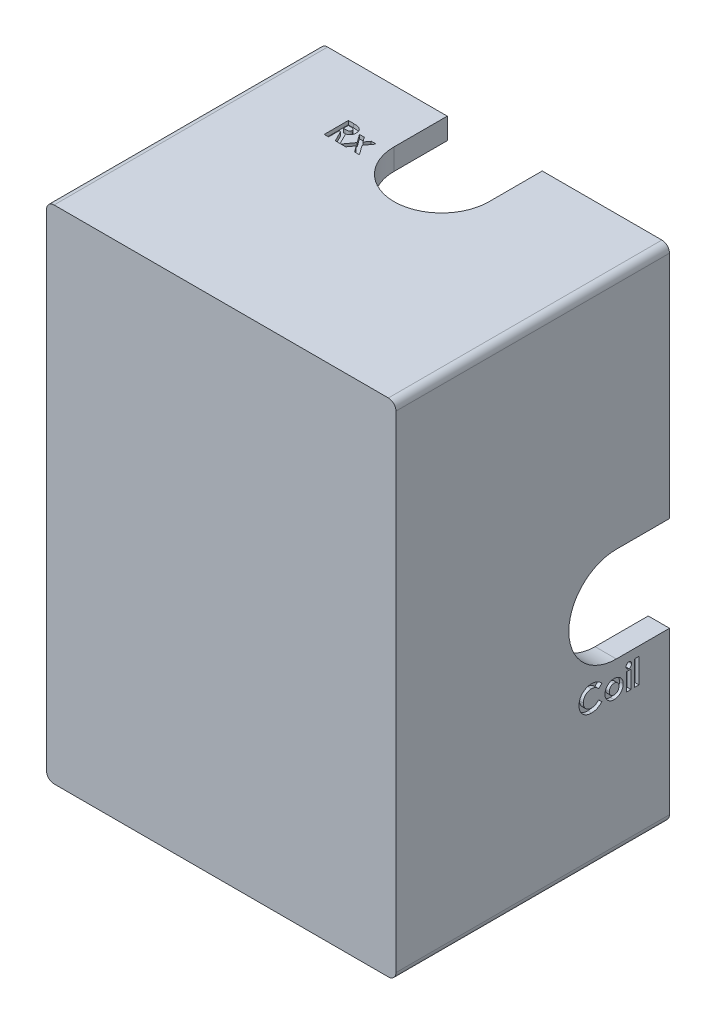
from build123d import *

# Parameters (mm, degrees)
SKETCH2_W            = 40
SKETCH2_H            = 33
BOSS_EXTRUDE3_DEPTH  = 3
SKETCH6_R            = 6.125
CUT_EXTRUDE2_DEPTH   = 3
SKETCH7_W            = 33
SKETCH7_H            = 3
BOSS_EXTRUDE6_DEPTH  = 3
SKETCH8_W            = 33
SKETCH8_H            = 3
BOSS_EXTRUDE7_DEPTH  = 3
SKETCH9_W            = 46
SKETCH9_H            = 3
BOSS_EXTRUDE8_DEPTH  = 3
SKETCH10_W           = 46
SKETCH10_H           = 3
BOSS_EXTRUDE9_DEPTH  = 3
SKETCH12_W           = 3
SKETCH12_H           = 33
CUT_EXTRUDE3_DEPTH   = 3
SKETCH13_W           = 3
SKETCH13_H           = 33
CUT_EXTRUDE4_DEPTH   = 3
SKETCH14_W           = 46
SKETCH14_H           = 3
BOSS_EXTRUDE10_DEPTH = 60
SKETCH15_W           = 46
SKETCH15_H           = 3
BOSS_EXTRUDE11_DEPTH = 60
BOSS_EXTRUDE12_DEPTH = 3
SKETCH18_R           = 6.25
CUT_EXTRUDE5_DEPTH   = 66
SKETCH19_W           = 46
SKETCH19_H           = 66
CUT_EXTRUDE6_DEPTH   = 3
SKETCH20_W           = 12.5
SKETCH20_H           = 7
CUT_EXTRUDE7_DEPTH   = 66
CUT_EXTRUDE9_DEPTH   = 0.5
CUT_EXTRUDE10_START  = -0.5
CUT_EXTRUDE10_DEPTH  = 0.5
SKETCH25_W           = 3
SKETCH25_H           = 66
BOSS_EXTRUDE13_DEPTH = 33
SKETCH27_R           = 6.25
CUT_EXTRUDE11_DEPTH  = 3
SKETCH31_W           = 3
SKETCH31_H           = 66
BOSS_EXTRUDE14_DEPTH = 33
SKETCH32_R           = 6.25
CUT_EXTRUDE14_DEPTH  = 3
CUT_EXTRUDE16_DEPTH  = 0.5
SKETCH35_W           = 0.569871795
SKETCH35_H           = 2.320192308
SKETCH35_W_2         = 0.569871794
SKETCH35_H_2         = 3.256410256
CUT_EXTRUDE17_DEPTH  = 0.5
SKETCH38_W           = 7
SKETCH38_H           = 12.5
CUT_EXTRUDE18_DEPTH  = 3
SKETCH39_W           = 26
SKETCH39_H           = 12.5
CUT_EXTRUDE19_DEPTH  = 3
SKETCH40_W           = 40
SKETCH40_H           = 33
CUT_EXTRUDE20_DEPTH  = 0.2
SKETCH41_W           = 40
SKETCH41_H           = 33
CUT_EXTRUDE21_DEPTH  = 0.2
SKETCH42_W           = 33
SKETCH42_H           = 60.4
CUT_EXTRUDE22_DEPTH  = 0.2
SKETCH43_W           = 33
SKETCH43_H           = 60.4
CUT_EXTRUDE23_DEPTH  = 0.2
FILLET1_R            = 1
FILLET2_R            = 1
FILLET3_R            = 1
FILLET4_R            = 1
SKETCH44_W           = 40.4
SKETCH44_H           = 60.4
CUT_EXTRUDE24_DEPTH  = 0.2


# Read off the part's stored shape, not the designer's step: Cut-Extrude10
with BuildPart() as part:
    # Sketch2 → Boss-Extrude3 (new body)
    with BuildSketch(Plane(origin=(0, 0, 0), x_dir=(1, 0, 0), z_dir=(0, 1, 0))):
        with Locations((31.325670542, 16.5)):
            Rectangle(SKETCH2_W, SKETCH2_H)
    extrude(amount=BOSS_EXTRUDE3_DEPTH)

    # Sketch6 → Cut-Extrude2 (cut)
    with BuildSketch(Plane(origin=(0, 3, 0), x_dir=(1, 0, 0), z_dir=(0, 1, 0))):
        with Locations(Location((31.325670542, 26, 0), (0, 0, 270))):
            Circle(SKETCH6_R)
    extrude(amount=-CUT_EXTRUDE2_DEPTH, mode=Mode.SUBTRACT)

    # Sketch7 → Boss-Extrude6 (add)
    with BuildSketch(Plane(origin=(51.325670542, 0, 0), x_dir=(0, 0, -1), z_dir=(1, 0, 0))):
        with Locations((16.5, 1.5)):
            Rectangle(SKETCH7_W, SKETCH7_H)
    extrude(amount=BOSS_EXTRUDE6_DEPTH)

    # Sketch8 → Boss-Extrude7 (add)
    with BuildSketch(Plane.ZY.offset(-11.325670542)):
        with Locations((-16.5, 1.5)):
            Rectangle(SKETCH8_W, SKETCH8_H)
    extrude(amount=BOSS_EXTRUDE7_DEPTH)

    # Sketch9 → Boss-Extrude8 (add)
    with BuildSketch(Plane(origin=(0, 0, -33), x_dir=(-1, 0, 0), z_dir=(0, 0, -1))):
        with Locations((-31.325670542, 1.5)):
            Rectangle(SKETCH9_W, SKETCH9_H)
    extrude(amount=BOSS_EXTRUDE8_DEPTH)

    # Sketch10 → Boss-Extrude9 (add)
    with BuildSketch(Plane.XY):
        with Locations((31.325670542, 1.5)):
            Rectangle(SKETCH10_W, SKETCH10_H)
    extrude(amount=BOSS_EXTRUDE9_DEPTH)

    # Sketch12 → Cut-Extrude3 (cut)
    with BuildSketch(Plane(origin=(0, 3, 0), x_dir=(1, 0, 0), z_dir=(0, 1, 0))):
        with Locations((9.825670542, 16.5)):
            Rectangle(SKETCH12_W, SKETCH12_H)
    extrude(amount=-CUT_EXTRUDE3_DEPTH, mode=Mode.SUBTRACT)

    # Sketch13 → Cut-Extrude4 (cut)
    with BuildSketch(Plane(origin=(0, 3, 0), x_dir=(1, 0, 0), z_dir=(0, 1, 0))):
        with Locations((52.825670542, 16.5)):
            Rectangle(SKETCH13_W, SKETCH13_H)
    extrude(amount=-CUT_EXTRUDE4_DEPTH, mode=Mode.SUBTRACT)

    # Sketch14 → Boss-Extrude10 (add)
    with BuildSketch(Plane(origin=(0, 3, 0), x_dir=(1, 0, 0), z_dir=(0, 1, 0))):
        with Locations((31.325670542, 34.5)):
            Rectangle(SKETCH14_W, SKETCH14_H)
    extrude(amount=BOSS_EXTRUDE10_DEPTH)

    # Sketch15 → Boss-Extrude11 (add)
    with BuildSketch(Plane(origin=(0, 3, 0), x_dir=(1, 0, 0), z_dir=(0, 1, 0))):
        with Locations((31.325670542, -1.5)):
            Rectangle(SKETCH15_W, SKETCH15_H)
    extrude(amount=BOSS_EXTRUDE11_DEPTH)

    # Sketch16 → Boss-Extrude12 (add)
    with BuildSketch(Plane(origin=(0, 63, 0), x_dir=(1, 0, 0), z_dir=(0, 1, 0))):
        Polygon((8.325670542, 36), (54.325670542, 36), (54.325670542, 33), (51.325670542, 33), (51.325670542, 0), (54.325670542, 0), (54.325670542, -3), (8.325670542, -3), (8.325670542, 0), (11.325670542, 0), (11.325670542, 33), (8.325670542, 33), align=None)
    extrude(amount=BOSS_EXTRUDE12_DEPTH)

    # Sketch18 → Cut-Extrude5 (cut)
    with BuildSketch(Plane.XZ):
        with Locations(Location((31.325670542, -26, 0), (0, 0, 270))):
            Circle(SKETCH18_R)
    extrude(amount=-CUT_EXTRUDE5_DEPTH, mode=Mode.SUBTRACT)

    # Sketch19 → Cut-Extrude6 (cut)
    with BuildSketch(Plane(origin=(0, 0, -36), x_dir=(-1, 0, 0), z_dir=(0, 0, -1))):
        with Locations((-31.325670542, 33)):
            Rectangle(SKETCH19_W, SKETCH19_H)
    extrude(amount=-CUT_EXTRUDE6_DEPTH, mode=Mode.SUBTRACT)

    # Sketch20 → Cut-Extrude7 (cut)
    with BuildSketch(Plane.XZ):
        with Locations((31.325670542, -29.5)):
            Rectangle(SKETCH20_W, SKETCH20_H)
    extrude(amount=-CUT_EXTRUDE7_DEPTH, mode=Mode.SUBTRACT)

    # Sketch22 → Cut-Extrude9 (cut)
    # profile 1 of 2: a face of its own
    with BuildSketch(Plane(origin=(0, 66, 0), x_dir=(1, 0, 0), z_dir=(0, 1, 0))):
        with BuildLine():
            Line((19.060108793, 25.990993015), (19.724111197, 25.990993015))
            add(Edge.make_bspline(
                [(19.724111197, 25.990993015), (19.768001553, 25.99083723), (19.852415073, 25.99053761), (19.974134757, 25.985810407), (20.085951026, 25.979232117), (20.188029434, 25.96919347), (20.280326311, 25.955883439), (20.362934159, 25.940193114), (20.435850563, 25.922310626), (20.499690473, 25.900027634), (20.557302835, 25.874892757), (20.611005566, 25.846012322), (20.661983429, 25.813707923), (20.70989569, 25.777129543), (20.75515872, 25.736935218), (20.797857909, 25.693084488), (20.837389878, 25.645205518), (20.873509844, 25.593600841), (20.906430285, 25.539313905), (20.935525051, 25.482270172), (20.959184963, 25.422429974), (20.980091031, 25.360658129), (20.995148995, 25.296071598), (21.005621588, 25.229299141), (21.013289212, 25.160105711), (21.013730063, 25.113098768), (21.013954947, 25.089120018)],
                knots=[0, 0, 0, 0, 1.749336639, 3.364467119, 4.854658419, 6.213483162, 7.451590619, 8.570285859, 9.5643256, 10.440900261, 11.26203566, 12.067320669, 12.869050712, 13.665104639, 14.467235401, 15.27997916, 16.102287765, 16.939272006, 17.78853747, 18.631303466, 19.488103222, 20.351255419, 21.228522269, 22.127379805, 23.044756219, 24, 24, 24, 24], degree=3))
            add(Edge.make_bspline(
                [(21.013954947, 25.089120018), (21.013370781, 25.064091712), (21.012225338, 25.015015766), (21.006055362, 24.942927203), (20.994778584, 24.873957909), (20.977698263, 24.808309816), (20.958066652, 24.745165859), (20.931961646, 24.685691081), (20.902499566, 24.62902051), (20.867508314, 24.575955771), (20.829107125, 24.525318191), (20.78444735, 24.479047883), (20.736422256, 24.434657994), (20.682332178, 24.394928955), (20.624561457, 24.357174432), (20.56196225, 24.32295878), (20.4949431, 24.291421897), (20.447825318, 24.273834752), (20.423730588, 24.264841172)],
                knots=[0, 0, 0, 0, 1.099860209, 2.156625411, 3.176576793, 4.16617041, 5.135385252, 6.078461593, 7.016046972, 7.938469504, 8.868247731, 9.803980173, 10.76021508, 11.73834243, 12.748633912, 13.790971185, 14.870363756, 16, 16, 16, 16], degree=3))
            Line((20.423730588, 24.264841172), (21.156422895, 22.815993015))
            Line((21.156422895, 22.815993015), (20.522949338, 22.815993015))
            Line((20.522949338, 22.815993015), (19.823329947, 24.199967374))
            Line((19.823329947, 24.199967374), (19.629980588, 24.199967374))
            Line((19.629980588, 24.199967374), (19.629980588, 22.815993015))
            Line((19.629980588, 22.815993015), (19.060108793, 22.815993015))
            Line((19.060108793, 22.815993015), (19.060108793, 25.990993015))
        make_face()
        with BuildLine():
            Line((19.629980588, 24.769839169), (19.85195074, 24.769839169))
            add(Edge.make_bspline(
                [(19.85195074, 24.769839169), (19.879088436, 24.770144812), (19.931051293, 24.770730053), (20.005780707, 24.773444641), (20.073652836, 24.779985458), (20.134959147, 24.788249536), (20.190008128, 24.797791608), (20.238308761, 24.811465976), (20.280605285, 24.826118407), (20.316396485, 24.844327578), (20.346975664, 24.865035355), (20.373378827, 24.888559904), (20.395218029, 24.915786575), (20.413192807, 24.945975463), (20.427175229, 24.979393582), (20.437381326, 25.015674077), (20.443085025, 25.055230229), (20.443741255, 25.08252936), (20.444083152, 25.09675223)],
                knots=[0, 0, 0, 0, 1.688639943, 3.233382647, 4.650958383, 5.928841754, 7.082724185, 8.122798841, 9.049171256, 9.863274652, 10.613301712, 11.341792392, 12.054588806, 12.776240173, 13.521029143, 14.301969904, 15.115324896, 16, 16, 16, 16], degree=3))
            add(Edge.make_bspline(
                [(20.444083152, 25.09675223), (20.443436765, 25.113578924), (20.442167059, 25.146631845), (20.429567627, 25.194216462), (20.409512053, 25.238259281), (20.382021354, 25.278561306), (20.347400393, 25.313892842), (20.307670109, 25.345037873), (20.261973026, 25.369665033), (20.219660966, 25.385908846), (20.181166881, 25.395627686), (20.146427184, 25.40287008), (20.106198406, 25.408002973), (20.060450176, 25.413447319), (20.009299108, 25.416977702), (19.952466399, 25.419554178), (19.89011527, 25.420608341), (19.846650611, 25.420945338), (19.823965964, 25.42112122)],
                knots=[0, 0, 0, 0, 1.020303359, 2.004196876, 2.966617323, 3.9489082, 4.950758222, 5.960522915, 7.003732012, 8.091992268, 8.70421221, 9.413913587, 10.24622431, 11.166358409, 12.212345909, 13.359657661, 14.621978493, 16, 16, 16, 16], degree=3))
            Line((19.823965964, 25.42112122), (19.629980588, 25.42112122))
            Line((19.629980588, 25.42112122), (19.629980588, 24.769839169))
        make_face(mode=Mode.SUBTRACT)
    # profile 2 of 2: a face of its own
    with BuildSketch(Plane(origin=(0, 66, 0), x_dir=(1, 0, 0), z_dir=(0, 1, 0))):
        Polygon((21.374576942, 25.136185323), (22.017590764, 25.136185323), (22.476159474, 24.5039838), (22.932820131, 25.136185323), (23.575833953, 25.136185323), (22.798620411, 24.059407478), (23.700493408, 22.815993015), (23.057479586, 22.815993015), (22.478067527, 23.614831156), (21.901199538, 22.815993015), (21.258185716, 22.815993015), (22.155606589, 24.059407478), align=None)
    extrude(amount=-CUT_EXTRUDE9_DEPTH, mode=Mode.SUBTRACT)

    # Cut-Extrude10 outline → Cut-Extrude10 (cut)
    with BuildSketch(Plane.XZ.offset(CUT_EXTRUDE10_START)):
        Polygon((41.883874939, -26.105349565), (41.314003144, -26.105349565), (41.314003144, -26.67522136), (43.023618529, -26.67522136), (43.023618529, -26.105349565), (42.453746734, -26.105349565), (42.453746734, -23.50022136), (41.883874939, -23.50022136), align=None)
        Polygon((40.661449058, -24.299059501), (40.084581069, -23.50022136), (39.441567247, -23.50022136), (40.33898812, -24.743635823), (39.557958473, -25.820413668), (40.200972295, -25.820413668), (40.659541005, -25.188212145), (41.116201662, -25.820413668), (41.759215484, -25.820413668), (40.982001942, -24.743635823), (41.873874939, -23.50022136), (41.240861117, -23.50022136), align=None)
    extrude(amount=CUT_EXTRUDE10_DEPTH, mode=Mode.SUBTRACT)

    # Sketch25 → Boss-Extrude13 (add)
    with BuildSketch(Plane(origin=(0, 0, 0), x_dir=(-1, 0, 0), z_dir=(0, 0, -1))):
        with Locations((-52.825670542, 33)):
            Rectangle(SKETCH25_W, SKETCH25_H)
    extrude(amount=BOSS_EXTRUDE13_DEPTH)

    # Sketch27 → Cut-Extrude11 (cut)
    with BuildSketch(Plane(origin=(54.325670542, 0, 0), x_dir=(0, 0, -1), z_dir=(1, 0, 0))):
        with Locations((26, 28.5)):
            Circle(SKETCH27_R)
    extrude(amount=-CUT_EXTRUDE11_DEPTH, mode=Mode.SUBTRACT)

    # Sketch31 → Boss-Extrude14 (add)
    with BuildSketch(Plane(origin=(0, 0, 0), x_dir=(-1, 0, 0), z_dir=(0, 0, -1))):
        with Locations((-9.825670542, 33)):
            Rectangle(SKETCH31_W, SKETCH31_H)
    extrude(amount=BOSS_EXTRUDE14_DEPTH)

    # Sketch32 → Cut-Extrude14 (cut)
    with BuildSketch(Plane.ZY.offset(-8.325670542)):
        with Locations((-7, 42)):
            Circle(SKETCH32_R)
    extrude(amount=-CUT_EXTRUDE14_DEPTH, mode=Mode.SUBTRACT)

    # Sketch34 → Cut-Extrude16 (cut)
    # profile 1 of 7: a face of its own
    with BuildSketch(Plane.ZY.offset(-8.325670542)):
        Polygon((-15.682463311, 33.617915865), (-15.153932662, 33.617915865), (-13.871721124, 30.442915865), (-14.480389994, 30.442915865), (-14.727164834, 31.094197917), (-16.110503175, 31.094197917), (-16.357278015, 30.442915865), (-16.965310867, 30.442915865), align=None)
        Polygon((-15.418515995, 32.766288261), (-15.894257181, 31.664069712), (-14.942774809, 31.664069712), align=None, mode=Mode.SUBTRACT)
    # profile 2 of 7: a face of its own
    with BuildSketch(Plane.ZY.offset(-8.325670542)):
        with BuildLine():
            Line((-10.554253175, 33.067124599), (-10.972116757, 32.667705529))
            add(Edge.make_bspline(
                [(-10.972116757, 32.667705529), (-11.00756335, 32.704357366), (-11.076801652, 32.775949886), (-11.188370612, 32.870732073), (-11.304398268, 32.949720201), (-11.422627534, 33.0162435), (-11.545185012, 33.066573117), (-11.670653602, 33.103249157), (-11.79983446, 33.125609152), (-11.887259096, 33.128167531), (-11.93123134, 33.129454327)],
                knots=[0, 0, 0, 0, 1.115251505, 2.178435587, 3.19620269, 4.182487026, 5.141301733, 6.088180966, 7.038406374, 8, 8, 8, 8], degree=3))
            add(Edge.make_bspline(
                [(-11.93123134, 33.129454327), (-11.967953507, 33.128437713), (-12.040420658, 33.126431538), (-12.146821426, 33.111724294), (-12.248599259, 33.086713985), (-12.34610256, 33.052245146), (-12.43904442, 33.007644299), (-12.527619703, 32.952945962), (-12.611610032, 32.88864414), (-12.689905942, 32.815071533), (-12.761528289, 32.734687931), (-12.824811193, 32.64891882), (-12.877820776, 32.557960692), (-12.921324878, 32.462734703), (-12.955212893, 32.362800101), (-12.979413193, 32.258224165), (-12.993409999, 32.148882354), (-12.995499116, 32.074552606), (-12.996560867, 32.036776042)],
                knots=[0, 0, 0, 0, 1.035432265, 2.043311493, 3.022114605, 3.98653278, 4.95457646, 5.923598177, 6.917315552, 7.932509744, 8.948865224, 9.949768934, 10.933144597, 11.912367597, 12.897413939, 13.903909035, 14.934704909, 16, 16, 16, 16], degree=3))
            add(Edge.make_bspline(
                [(-12.996560867, 32.036776042), (-12.996254883, 32.010261805), (-12.995651781, 31.958001701), (-12.989049766, 31.880694503), (-12.978418966, 31.805688244), (-12.963033565, 31.733096539), (-12.943793968, 31.66285648), (-12.921221541, 31.594362109), (-12.892904764, 31.528559864), (-12.861472713, 31.464685495), (-12.824917601, 31.404481894), (-12.785504446, 31.347072763), (-12.742767315, 31.292739518), (-12.696429395, 31.241704273), (-12.64583854, 31.194764596), (-12.592302335, 31.150508954), (-12.534917698, 31.110045216), (-12.474876655, 31.072357901), (-12.411660525, 31.039618609), (-12.34698451, 31.009963135), (-12.27986799, 30.985878482), (-12.21112815, 30.966464054), (-12.141010641, 30.949954982), (-12.068829649, 30.93978984), (-11.995210893, 30.932091896), (-11.945456971, 30.931616593), (-11.92041904, 30.931377404)],
                knots=[0, 0, 0, 0, 1.103660481, 2.175337485, 3.227646561, 4.255952547, 5.262355991, 6.258840057, 7.255597736, 8.242457506, 9.22035537, 10.185017736, 11.140346927, 12.096287581, 13.051739095, 14.01125915, 14.986044842, 15.97314143, 16.960198552, 17.947847494, 18.933482797, 19.925264591, 20.920966487, 21.929612487, 22.958107872, 24, 24, 24, 24], degree=3))
            add(Edge.make_bspline(
                [(-11.92041904, 30.931377404), (-11.877950406, 30.932605822), (-11.794510584, 30.935019345), (-11.672050648, 30.953892748), (-11.555358528, 30.98493843), (-11.462122083, 31.021601575), (-11.389073791, 31.057806907), (-11.333463206, 31.091295057), (-11.275957527, 31.128755229), (-11.217511874, 31.17160121), (-11.157468849, 31.219318833), (-11.096888351, 31.272953202), (-11.034219507, 31.330738214), (-10.993165768, 31.371980512), (-10.972116757, 31.393126202)],
                knots=[0, 0, 0, 0, 1.404581149, 2.759636711, 4.088442092, 5.392261763, 6.066678138, 6.783632037, 7.538459478, 8.336747902, 9.180226004, 10.074962426, 11.012997595, 12, 12, 12, 12], degree=3))
            Line((-10.972116757, 31.393126202), (-10.566973527, 30.967630409))
            add(Edge.make_bspline(
                [(-10.566973527, 30.967630409), (-10.595452916, 30.940134453), (-10.651038591, 30.886468229), (-10.734888039, 30.810267198), (-10.81863196, 30.7417921), (-10.900247274, 30.678557591), (-10.981070925, 30.622405844), (-11.061094343, 30.57328078), (-11.139411627, 30.529939956), (-11.21764906, 30.493114293), (-11.296293477, 30.46184548), (-11.37720934, 30.434925084), (-11.460644016, 30.412151398), (-11.547107087, 30.393776024), (-11.635792078, 30.379041455), (-11.727528962, 30.369095706), (-11.821736082, 30.36240951), (-11.885638231, 30.3618087), (-11.91787497, 30.361505609)],
                knots=[0, 0, 0, 0, 1.244526981, 2.429050516, 3.560637417, 4.644440555, 5.67424972, 6.652764056, 7.595344123, 8.486817594, 9.369275933, 10.254498637, 11.166417451, 12.086725134, 13.032340136, 13.991389299, 14.986715468, 16, 16, 16, 16], degree=3))
            add(Edge.make_bspline(
                [(-11.91787497, 30.361505609), (-11.977089866, 30.363015115), (-12.092956959, 30.365968798), (-12.262757163, 30.387853591), (-12.424062798, 30.424543062), (-12.577266291, 30.476432092), (-12.722318928, 30.542717897), (-12.859183599, 30.623981181), (-12.987639708, 30.720006041), (-13.106649584, 30.829666972), (-13.214299681, 30.950778265), (-13.3094499, 31.080818567), (-13.388158164, 31.220426979), (-13.453511332, 31.36754104), (-13.50461665, 31.522832088), (-13.54058613, 31.686468099), (-13.562768246, 31.858291075), (-13.565195001, 31.975650128), (-13.566432662, 32.035504006)],
                knots=[0, 0, 0, 0, 1.078019885, 2.10938526, 3.111377082, 4.085535484, 5.04941344, 6.010039228, 6.978205633, 7.964457913, 8.951525778, 9.924444315, 10.892603023, 11.863865945, 12.85144698, 13.863884204, 14.910567087, 16, 16, 16, 16], degree=3))
            add(Edge.make_bspline(
                [(-13.566432662, 32.035504006), (-13.565909687, 32.074540195), (-13.564873277, 32.151900381), (-13.553980517, 32.265858202), (-13.538795375, 32.376946693), (-13.514705529, 32.484012388), (-13.485667596, 32.58849766), (-13.44955511, 32.689266874), (-13.40642575, 32.786609653), (-13.357669675, 32.880688955), (-13.302512415, 32.970888457), (-13.2408957, 33.056433206), (-13.174405786, 33.13798359), (-13.101445027, 33.214457692), (-13.023073639, 33.28652697), (-12.938937784, 33.353800867), (-12.849543498, 33.417244166), (-12.754648823, 33.475220818), (-12.65609731, 33.527663782), (-12.555131952, 33.573920715), (-12.452000811, 33.61258086), (-12.347139934, 33.644648023), (-12.240106284, 33.668583894), (-12.131663842, 33.686702575), (-12.020889891, 33.696831034), (-11.94651478, 33.698489127), (-11.908970723, 33.699326122)],
                knots=[0, 0, 0, 0, 1.071919942, 2.124283339, 3.142214191, 4.149696895, 5.136002878, 6.119640489, 7.086990633, 8.058538607, 9.028339693, 9.988281803, 10.952401235, 11.916291999, 12.888973767, 13.874849856, 14.873389453, 15.898127285, 16.927174885, 17.938320013, 18.946391617, 19.950418109, 20.947802303, 21.956882652, 22.968648068, 24, 24, 24, 24], degree=3))
            add(Edge.make_bspline(
                [(-11.908970723, 33.699326122), (-11.876941793, 33.698846336), (-11.813216944, 33.697891752), (-11.71831995, 33.689934258), (-11.624181898, 33.677437095), (-11.531139832, 33.658581536), (-11.438528217, 33.636197605), (-11.347564077, 33.606888936), (-11.256812401, 33.5742189), (-11.167696494, 33.535168543), (-11.080091966, 33.492541551), (-10.996051088, 33.444179681), (-10.914162823, 33.393059068), (-10.836241766, 33.33615417), (-10.760828287, 33.275529033), (-10.688316731, 33.210900808), (-10.619343427, 33.141191953), (-10.576059612, 33.091938531), (-10.554253175, 33.067124599)],
                knots=[0, 0, 0, 0, 0.996412454, 1.982464992, 2.961075852, 3.949442424, 4.934965278, 5.923860011, 6.921385422, 7.934793307, 8.949617135, 9.951082467, 10.950285876, 11.951772932, 12.951063433, 13.960125323, 14.972308753, 16, 16, 16, 16], degree=3))
        make_face()
    # profile 3 of 7: a face of its own
    with BuildSketch(Plane.ZY.offset(-8.325670542)):
        Polygon((-10.310022406, 33.617915865), (-8.600407021, 33.617915865), (-8.600407021, 33.048044071), (-9.170278816, 33.048044071), (-9.170278816, 30.442915865), (-9.740150611, 30.442915865), (-9.740150611, 33.048044071), (-10.310022406, 33.048044071), align=None)
    # profile 4 of 7: a face of its own
    with BuildSketch(Plane.ZY.offset(-8.325670542)):
        Polygon((-8.437586508, 29.873044071), (-6.976654016, 33.699326122), (-6.544798047, 33.699326122), (-8.005730539, 29.873044071), align=None)
    # profile 5 of 7: a face of its own
    with BuildSketch(Plane.ZY.offset(-8.325670542)):
        with BuildLine():
            Line((-6.117394201, 33.617915865), (-5.399330298, 33.617915865))
            add(Edge.make_bspline(
                [(-5.399330298, 33.617915865), (-5.343348958, 33.617524537), (-5.235136394, 33.616768094), (-5.078357797, 33.608244802), (-4.932573652, 33.595136584), (-4.797689984, 33.577103855), (-4.673983327, 33.553241616), (-4.561613197, 33.523311115), (-4.460202453, 33.48876133), (-4.368639147, 33.448106497), (-4.285050656, 33.400707), (-4.205680716, 33.347907765), (-4.130685169, 33.287774603), (-4.059011569, 33.221467602), (-3.991584881, 33.147773695), (-3.927282207, 33.067913522), (-3.867677971, 32.980728998), (-3.810970463, 32.888310535), (-3.759686068, 32.790266471), (-3.714953903, 32.687431337), (-3.677481497, 32.580466916), (-3.647033226, 32.469259211), (-3.622762441, 32.354177398), (-3.605780661, 32.234989253), (-3.595282356, 32.111805123), (-3.594217391, 32.028317191), (-3.593676252, 31.985894631)],
                knots=[0, 0, 0, 0, 1.44355588, 2.790409838, 4.047694926, 5.217575253, 6.298404546, 7.294384826, 8.214239204, 9.058592145, 9.873746385, 10.689560431, 11.514393297, 12.350027578, 13.205127629, 14.088021785, 14.991911688, 15.926770944, 16.882954281, 17.842803888, 18.816321264, 19.80318086, 20.814351908, 21.847355356, 22.906180909, 24, 24, 24, 24], degree=3))
            add(Edge.make_bspline(
                [(-3.593676252, 31.985894631), (-3.595093245, 31.926033639), (-3.597882679, 31.808193772), (-3.621379315, 31.635265124), (-3.659381332, 31.469495767), (-3.712815619, 31.312182414), (-3.77905983, 31.164725963), (-3.858195959, 31.029726747), (-3.949063685, 30.907909372), (-4.050604393, 30.799880391), (-4.160548251, 30.707028017), (-4.274802089, 30.627506754), (-4.394478948, 30.564797603), (-4.499930987, 30.525030623), (-4.59137106, 30.500299002), (-4.671654455, 30.485682376), (-4.7628482, 30.472278049), (-4.865802598, 30.461919473), (-4.980066009, 30.452682168), (-5.10609389, 30.447662977), (-5.243478199, 30.443492774), (-5.338904591, 30.443113207), (-5.388517999, 30.442915865)],
                knots=[0, 0, 0, 0, 1.315458931, 2.589557908, 3.828601765, 5.048913369, 6.235739168, 7.376350998, 8.481830359, 9.569842114, 10.627874879, 11.640079404, 12.624025415, 13.590060155, 14.111227486, 14.704434459, 15.382649715, 16.137166398, 16.978595427, 17.902333227, 18.909396075, 20, 20, 20, 20], degree=3))
            Line((-5.388517999, 30.442915865), (-6.117394201, 30.442915865))
            Line((-6.117394201, 30.442915865), (-6.117394201, 33.617915865))
        make_face()
        with BuildLine():
            Line((-5.547522406, 33.048044071), (-5.547522406, 31.01278766))
            Line((-5.547522406, 31.01278766), (-5.249866156, 31.01278766))
            add(Edge.make_bspline(
                [(-5.249866156, 31.01278766), (-5.214449633, 31.012852558), (-5.14633187, 31.012977378), (-5.04798524, 31.01892266), (-4.957039543, 31.024890083), (-4.873745133, 31.036216452), (-4.797495817, 31.04883323), (-4.729339063, 31.066391204), (-4.667869863, 31.084834368), (-4.613839052, 31.108314803), (-4.564351231, 31.134743594), (-4.518531162, 31.165707987), (-4.474301966, 31.200092778), (-4.432490545, 31.238909272), (-4.392938652, 31.281643466), (-4.355880301, 31.32851555), (-4.320820861, 31.379382516), (-4.288660242, 31.434513311), (-4.259271697, 31.493325741), (-4.233200763, 31.555250121), (-4.211584112, 31.620802149), (-4.193617676, 31.689368178), (-4.180778619, 31.761545154), (-4.170156749, 31.836798472), (-4.164680866, 31.915426279), (-4.163929335, 31.968927266), (-4.163548047, 31.996070913)],
                knots=[0, 0, 0, 0, 1.50275155, 2.890291501, 4.180787663, 5.369391935, 6.45668281, 7.458360028, 8.354766181, 9.177074746, 9.954075863, 10.732690366, 11.5210699, 12.329727389, 13.151100085, 13.990027547, 14.863562427, 15.770965086, 16.696477834, 17.652329173, 18.619756807, 19.62365428, 20.657822005, 21.729286259, 22.847956731, 24, 24, 24, 24], degree=3))
            add(Edge.make_bspline(
                [(-4.163548047, 31.996070913), (-4.164307443, 32.037665987), (-4.165788207, 32.118773157), (-4.180068377, 32.236907521), (-4.203313769, 32.348148721), (-4.236482703, 32.452083913), (-4.278293173, 32.549005209), (-4.330628722, 32.638091479), (-4.391237031, 32.720839251), (-4.439164427, 32.769381749), (-4.46311235, 32.793637019)],
                knots=[0, 0, 0, 0, 1.13821349, 2.219428113, 3.251817212, 4.244760574, 5.201143372, 6.134805572, 7.068016741, 8, 8, 8, 8], degree=3))
            add(Edge.make_bspline(
                [(-4.46311235, 32.793637019), (-4.486727269, 32.814305789), (-4.534958067, 32.85651941), (-4.619635499, 32.907102124), (-4.712945643, 32.951543996), (-4.817023156, 32.986781445), (-4.930862176, 33.014648721), (-5.055140728, 33.0338681), (-5.189193276, 33.046218269), (-5.282061758, 33.047422431), (-5.330004377, 33.048044071)],
                knots=[0, 0, 0, 0, 0.813307809, 1.661089106, 2.549956539, 3.493439533, 4.508053171, 5.589449661, 6.755572447, 8, 8, 8, 8], degree=3))
            Line((-5.330004377, 33.048044071), (-5.547522406, 33.048044071))
        make_face(mode=Mode.SUBTRACT)
    # profile 6 of 7: a face of its own
    with BuildSketch(Plane.ZY.offset(-8.325670542)):
        Polygon((-3.023804457, 33.617915865), (-1.314189072, 33.617915865), (-1.314189072, 33.048044071), (-2.453932662, 33.048044071), (-2.453932662, 32.437467147), (-1.314189072, 32.437467147), (-1.314189072, 31.867595353), (-2.453932662, 31.867595353), (-2.453932662, 31.01278766), (-1.314189072, 31.01278766), (-1.314189072, 30.442915865), (-3.023804457, 30.442915865), align=None)
    # profile 7 of 7: a face of its own
    with BuildSketch(Plane.ZY.offset(-8.325670542)):
        Polygon((-1.069958303, 33.617915865), (0.639657082, 33.617915865), (0.639657082, 33.048044071), (0.069785287, 33.048044071), (0.069785287, 30.442915865), (-0.500086508, 30.442915865), (-0.500086508, 33.048044071), (-1.069958303, 33.048044071), align=None)
    extrude(amount=-CUT_EXTRUDE16_DEPTH, mode=Mode.SUBTRACT)

    # Sketch35 → Cut-Extrude17 (cut)
    # profile 1 of 5: a face of its own
    with BuildSketch(Plane(origin=(54.325670542, 0, 0), x_dir=(0, 0, -1), z_dir=(1, 0, 0))):
        with BuildLine():
            Line((24.101823325, 20.426444538), (23.683959743, 20.027025467))
            add(Edge.make_bspline(
                [(23.683959743, 20.027025467), (23.64851315, 20.063677304), (23.579274848, 20.135269824), (23.467705888, 20.230052011), (23.351678232, 20.30904014), (23.233448966, 20.375563439), (23.110891488, 20.425893056), (22.985422897, 20.462569095), (22.856242039, 20.48492909), (22.768817404, 20.487487469), (22.72484516, 20.488774265)],
                knots=[0, 0, 0, 0, 1.115251505, 2.178435587, 3.19620269, 4.182487026, 5.141301733, 6.088180966, 7.038406374, 8, 8, 8, 8], degree=3))
            add(Edge.make_bspline(
                [(22.72484516, 20.488774265), (22.688122993, 20.487757652), (22.615655841, 20.485751476), (22.509255074, 20.471044232), (22.40747724, 20.446033923), (22.30997394, 20.411565085), (22.21703208, 20.366964237), (22.128456796, 20.312265901), (22.044466468, 20.247964078), (21.966170558, 20.174391472), (21.894548211, 20.09400787), (21.831265307, 20.008238759), (21.778255724, 19.91728063), (21.734751621, 19.822054641), (21.700863607, 19.722120039), (21.676663307, 19.617544104), (21.662666501, 19.508202293), (21.660577383, 19.433872545), (21.659515633, 19.39609598)],
                knots=[0, 0, 0, 0, 1.035432265, 2.043311493, 3.022114605, 3.98653278, 4.95457646, 5.923598177, 6.917315552, 7.932509744, 8.948865224, 9.949768934, 10.933144597, 11.912367597, 12.897413939, 13.903909035, 14.934704909, 16, 16, 16, 16], degree=3))
            add(Edge.make_bspline(
                [(21.659515633, 19.39609598), (21.659821617, 19.369581744), (21.660424719, 19.31732164), (21.667026733, 19.240014441), (21.677657533, 19.165008182), (21.693042935, 19.092416478), (21.712282531, 19.022176418), (21.734854958, 18.953682047), (21.763171736, 18.887879802), (21.794603786, 18.824005433), (21.831158899, 18.763801832), (21.870572054, 18.706392702), (21.913309185, 18.652059456), (21.959647104, 18.601024212), (22.01023796, 18.554084534), (22.063774165, 18.509828893), (22.121158801, 18.469365155), (22.181199845, 18.431677839), (22.244415974, 18.398938547), (22.30909199, 18.369283074), (22.37620851, 18.34519842), (22.44494835, 18.325783992), (22.515065859, 18.309274921), (22.58724685, 18.299109778), (22.660865606, 18.291411835), (22.710619528, 18.290936532), (22.735657459, 18.290697342)],
                knots=[0, 0, 0, 0, 1.103660481, 2.175337485, 3.227646561, 4.255952547, 5.262355991, 6.258840057, 7.255597736, 8.242457506, 9.22035537, 10.185017736, 11.140346927, 12.096287581, 13.051739095, 14.01125915, 14.986044842, 15.97314143, 16.960198552, 17.947847494, 18.933482797, 19.925264591, 20.920966487, 21.929612487, 22.958107872, 24, 24, 24, 24], degree=3))
            add(Edge.make_bspline(
                [(22.735657459, 18.290697342), (22.778126093, 18.291925761), (22.861565916, 18.294339283), (22.984025852, 18.313212687), (23.100717972, 18.344258368), (23.193954417, 18.380921514), (23.267002709, 18.417126846), (23.322613294, 18.450614995), (23.380118973, 18.488075167), (23.438564626, 18.530921149), (23.498607651, 18.578638772), (23.559188149, 18.63227314), (23.621856993, 18.690058152), (23.662910731, 18.731300451), (23.683959743, 18.75244614)],
                knots=[0, 0, 0, 0, 1.404581149, 2.759636711, 4.088442092, 5.392261763, 6.066678138, 6.783632037, 7.538459478, 8.336747902, 9.180226004, 10.074962426, 11.012997595, 12, 12, 12, 12], degree=3))
            Line((23.683959743, 18.75244614), (24.089102972, 18.326950347))
            add(Edge.make_bspline(
                [(24.089102972, 18.326950347), (24.060623584, 18.299454392), (24.005037909, 18.245788167), (23.92118846, 18.169587136), (23.83744454, 18.101112039), (23.755829226, 18.037877529), (23.675005574, 17.981725782), (23.594982157, 17.932600719), (23.516664873, 17.889259894), (23.43842744, 17.852434231), (23.359783023, 17.821165418), (23.27886716, 17.794245023), (23.195432483, 17.771471336), (23.108969412, 17.753095963), (23.020284422, 17.738361393), (22.928547538, 17.728415645), (22.834340418, 17.721729448), (22.770438269, 17.721128638), (22.73820153, 17.720825547)],
                knots=[0, 0, 0, 0, 1.244526981, 2.429050516, 3.560637417, 4.644440555, 5.67424972, 6.652764056, 7.595344123, 8.486817594, 9.369275933, 10.254498637, 11.166417451, 12.086725134, 13.032340136, 13.991389299, 14.986715468, 16, 16, 16, 16], degree=3))
            add(Edge.make_bspline(
                [(22.73820153, 17.720825547), (22.678986633, 17.722335053), (22.563119541, 17.725288736), (22.393319337, 17.74717353), (22.232013702, 17.783863), (22.078810208, 17.835752031), (21.933757572, 17.902037836), (21.796892901, 17.98330112), (21.668436791, 18.07932598), (21.549426916, 18.188986911), (21.441776819, 18.310098203), (21.3466266, 18.440138505), (21.267918335, 18.579746918), (21.202565167, 18.726860979), (21.151459849, 18.882152026), (21.115490369, 19.045788038), (21.093308253, 19.217611013), (21.090881498, 19.334970066), (21.089643838, 19.394823945)],
                knots=[0, 0, 0, 0, 1.078019885, 2.10938526, 3.111377082, 4.085535484, 5.04941344, 6.010039228, 6.978205633, 7.964457913, 8.951525778, 9.924444315, 10.892603023, 11.863865945, 12.85144698, 13.863884204, 14.910567087, 16, 16, 16, 16], degree=3))
            add(Edge.make_bspline(
                [(21.089643838, 19.394823945), (21.090166813, 19.433860134), (21.091203223, 19.511220319), (21.102095983, 19.62517814), (21.117281124, 19.736266631), (21.14137097, 19.843332326), (21.170408904, 19.947817598), (21.206521389, 20.048586813), (21.24965075, 20.145929592), (21.298406825, 20.240008893), (21.353564085, 20.330208396), (21.415180799, 20.415753144), (21.481670714, 20.497303528), (21.554631473, 20.573777631), (21.633002861, 20.645846909), (21.717138716, 20.713120806), (21.806533002, 20.776564104), (21.901427677, 20.834540757), (21.99997919, 20.88698372), (22.100944547, 20.933240654), (22.204075689, 20.971900798), (22.308936566, 21.003967962), (22.415970215, 21.027903832), (22.524412658, 21.046022514), (22.635186608, 21.056150972), (22.70956172, 21.057809066), (22.747105777, 21.05864606)],
                knots=[0, 0, 0, 0, 1.071919942, 2.124283339, 3.142214191, 4.149696895, 5.136002878, 6.119640489, 7.086990633, 8.058538607, 9.028339693, 9.988281803, 10.952401235, 11.916291999, 12.888973767, 13.874849856, 14.873389453, 15.898127285, 16.927174885, 17.938320013, 18.946391617, 19.950418109, 20.947802303, 21.956882652, 22.968648068, 24, 24, 24, 24], degree=3))
            add(Edge.make_bspline(
                [(22.747105777, 21.05864606), (22.779134707, 21.058166274), (22.842859556, 21.05721169), (22.937756549, 21.049254197), (23.031894601, 21.036757033), (23.124936668, 21.017901474), (23.217548282, 20.995517544), (23.308512423, 20.966208874), (23.399264099, 20.933538838), (23.488380005, 20.894488482), (23.575984534, 20.85186149), (23.660025412, 20.803499619), (23.741913676, 20.752379006), (23.819834733, 20.695474108), (23.895248212, 20.634848972), (23.967759769, 20.570220747), (24.036733072, 20.500511891), (24.080016888, 20.451258469), (24.101823325, 20.426444538)],
                knots=[0, 0, 0, 0, 0.996412454, 1.982464992, 2.961075852, 3.949442424, 4.934965278, 5.923860011, 6.921385422, 7.934793307, 8.949617135, 9.951082467, 10.950285876, 11.951772932, 12.951063433, 13.960125323, 14.972308753, 16, 16, 16, 16], degree=3))
        make_face()
    # profile 2 of 5: a face of its own
    with BuildSketch(Plane(origin=(54.325670542, 0, 0), x_dir=(0, 0, -1), z_dir=(1, 0, 0))):
        with BuildLine():
            add(Edge.make_bspline(
                [(25.695683501, 20.16313324), (25.722625939, 20.162653781), (25.775984175, 20.161704234), (25.855454602, 20.153800128), (25.933535703, 20.140904253), (26.010676277, 20.124206346), (26.086160002, 20.100810081), (26.160382781, 20.072749879), (26.234008261, 20.040533485), (26.305209071, 20.002184708), (26.374499583, 19.960591962), (26.440191113, 19.914711751), (26.501738137, 19.864904447), (26.560283178, 19.812324873), (26.613097942, 19.754683885), (26.663557575, 19.694758868), (26.708935867, 19.630402917), (26.750949629, 19.563184239), (26.788354179, 19.493491546), (26.820833152, 19.421809644), (26.849021847, 19.349129588), (26.87109303, 19.274566083), (26.889365935, 19.19910235), (26.900897437, 19.121813636), (26.909095535, 19.043493891), (26.910014802, 18.990762593), (26.910477171, 18.964240011)],
                knots=[0, 0, 0, 0, 1.022364134, 2.024744242, 3.027414945, 4.024939316, 5.017584196, 6.023349371, 7.035562955, 8.064994934, 9.090267829, 10.101425541, 11.102933353, 12.093946398, 13.084502048, 14.067315274, 15.065326281, 16.070028806, 17.074376865, 18.064572984, 19.055292013, 20.030201733, 21.013838017, 21.999348303, 22.993720005, 24, 24, 24, 24], degree=3))
            add(Edge.make_bspline(
                [(26.910477171, 18.964240011), (26.909989217, 18.93751022), (26.909019054, 18.884365338), (26.901194034, 18.805308898), (26.888248798, 18.727656732), (26.871486804, 18.650951375), (26.848178094, 18.576174348), (26.820944355, 18.502223406), (26.787513868, 18.430106529), (26.750554003, 18.35903699), (26.70827011, 18.291106148), (26.662931098, 18.226105507), (26.612682814, 18.165740337), (26.560290847, 18.108138548), (26.503270128, 18.055247974), (26.442530813, 18.006209813), (26.378598736, 17.960424551), (26.311014159, 17.918966398), (26.240642726, 17.882538597), (26.16867124, 17.849695962), (26.09467885, 17.822352124), (26.018818688, 17.800053976), (25.941044747, 17.782789079), (25.861528732, 17.771060828), (25.780441891, 17.762903966), (25.725808771, 17.761991386), (25.698227572, 17.761530676)],
                knots=[0, 0, 0, 0, 1.012026251, 2.012137606, 3.004615893, 3.992048833, 4.982446996, 5.968083444, 6.973977695, 7.990229942, 8.999482246, 10.001782172, 10.988562221, 11.971415814, 12.948383116, 13.930088534, 14.925840678, 15.924049238, 16.929462851, 17.924729459, 18.917889337, 19.913673841, 20.916777188, 21.931792057, 22.95587778, 24, 24, 24, 24], degree=3))
            add(Edge.make_bspline(
                [(25.698227572, 17.761530676), (25.657898234, 17.762714421), (25.578408497, 17.765047602), (25.461338906, 17.781029278), (25.348873676, 17.808537933), (25.240829543, 17.846884392), (25.137066158, 17.89602395), (25.038489083, 17.956841614), (24.944117745, 18.028140061), (24.855586727, 18.109316668), (24.774480321, 18.198374757), (24.703624118, 18.293443725), (24.643461467, 18.393098647), (24.594046497, 18.497453163), (24.555908217, 18.606650372), (24.528365871, 18.720363813), (24.512364655, 18.838913116), (24.510051208, 18.919458933), (24.508874607, 18.960423905)],
                knots=[0, 0, 0, 0, 1.029999031, 2.030143771, 3.011211297, 3.982305373, 4.953580601, 5.938004764, 6.935448627, 7.970290061, 9.001484052, 10.007591832, 10.993831261, 11.969999897, 12.951306496, 13.942897864, 14.953773953, 16, 16, 16, 16], degree=3))
            add(Edge.make_bspline(
                [(24.508874607, 18.960423905), (24.51009224, 19.004165515), (24.512485473, 19.090138774), (24.531488796, 19.216091557), (24.561835052, 19.336685378), (24.605395192, 19.451582897), (24.661039439, 19.560996027), (24.728968455, 19.664694005), (24.809517947, 19.762700318), (24.871202729, 19.821977896), (24.902569519, 19.85212062)],
                knots=[0, 0, 0, 0, 1.043912699, 2.05178951, 3.033892, 4.007821512, 4.978932272, 5.95884105, 6.962068106, 8, 8, 8, 8], degree=3))
            add(Edge.make_bspline(
                [(24.902569519, 19.85212062), (24.931351683, 19.877105546), (24.988132936, 19.926395635), (25.080383782, 19.988912032), (25.17483824, 20.042907126), (25.272628386, 20.087301136), (25.374026833, 20.120773503), (25.478513972, 20.145138391), (25.586068077, 20.16010402), (25.658959342, 20.162118368), (25.695683501, 20.16313324)],
                knots=[0, 0, 0, 0, 1.048115528, 2.067714963, 3.060638214, 4.039924844, 5.017819947, 5.994373833, 6.98952318, 8, 8, 8, 8], degree=3))
        make_face()
        with BuildLine():
            add(Edge.make_bspline(
                [(25.708403854, 19.633966573), (25.686339982, 19.633233243), (25.642907012, 19.631789675), (25.57897254, 19.624042431), (25.518502642, 19.608163788), (25.460296275, 19.587970501), (25.405383115, 19.560964825), (25.352259285, 19.52936196), (25.303687108, 19.489814863), (25.257316022, 19.446434591), (25.215221411, 19.398261963), (25.179352806, 19.345777922), (25.147303412, 19.290990395), (25.123001982, 19.231893544), (25.102890226, 19.170102657), (25.08927883, 19.104619382), (25.07980625, 19.036175202), (25.079103045, 18.989290469), (25.078746402, 18.965512046)],
                knots=[0, 0, 0, 0, 1.030650113, 2.02884584, 2.99876339, 3.944280128, 4.900564847, 5.851248946, 6.823638398, 7.81794922, 8.81432732, 9.802856497, 10.78262424, 11.771747962, 12.779760563, 13.812642396, 14.89064281, 16, 16, 16, 16], degree=3))
            add(Edge.make_bspline(
                [(25.078746402, 18.965512046), (25.079163722, 18.940895076), (25.079979295, 18.892785935), (25.088424725, 18.822540119), (25.102351516, 18.755877306), (25.122137122, 18.692900475), (25.147020862, 18.633157586), (25.177550325, 18.576983836), (25.214047716, 18.524716978), (25.255426899, 18.476421373), (25.300735337, 18.432582918), (25.350380781, 18.394962396), (25.402284268, 18.362275156), (25.457641934, 18.336022257), (25.515667542, 18.315752889), (25.576533348, 18.300829235), (25.640559199, 18.292789094), (25.684214712, 18.29140418), (25.706495801, 18.290697342)],
                knots=[0, 0, 0, 0, 1.141730614, 2.231293227, 3.276944405, 4.297399982, 5.28939179, 6.275415646, 7.257752684, 8.24146775, 9.222424823, 10.176631434, 11.126518621, 12.063689483, 13.012557477, 13.974037417, 14.965980454, 16, 16, 16, 16], degree=3))
            add(Edge.make_bspline(
                [(25.706495801, 18.290697342), (25.728788034, 18.291324276), (25.772493752, 18.292553429), (25.83659479, 18.301757847), (25.89777142, 18.316243788), (25.956292613, 18.336687607), (26.011685219, 18.363502435), (26.064161285, 18.396346056), (26.11418245, 18.434489845), (26.160098932, 18.479155448), (26.202602941, 18.52760167), (26.239876414, 18.580144441), (26.271023535, 18.636318205), (26.296569751, 18.695769515), (26.316394143, 18.758416657), (26.330090373, 18.82449248), (26.339568019, 18.893792213), (26.34025532, 18.941310188), (26.340605376, 18.965512046)],
                knots=[0, 0, 0, 0, 1.031504075, 2.022346795, 2.991027682, 3.937587355, 4.885570121, 5.833146507, 6.798790848, 7.791235734, 8.792807298, 9.778388351, 10.766749885, 11.760164525, 12.768777521, 13.802286646, 14.880660483, 16, 16, 16, 16], degree=3))
            add(Edge.make_bspline(
                [(26.340605376, 18.965512046), (26.340182747, 18.989705445), (26.339353411, 19.037180744), (26.330907379, 19.106574203), (26.317117262, 19.172436451), (26.297076465, 19.234486262), (26.272340631, 19.293431525), (26.241790066, 19.348970522), (26.205112681, 19.40082971), (26.163532342, 19.44875194), (26.117544703, 19.491975242), (26.068761223, 19.530519934), (26.016066375, 19.562399356), (25.960448747, 19.58867938), (25.901760365, 19.608898107), (25.840067118, 19.623906337), (25.775179934, 19.631832071), (25.730895177, 19.633247636), (25.708403854, 19.633966573)],
                knots=[0, 0, 0, 0, 1.123894411, 2.205445421, 3.243160173, 4.246488011, 5.231014757, 6.210004299, 7.185865357, 8.177612767, 9.153374344, 10.115157457, 11.061423229, 12.009021698, 12.96873347, 13.94135618, 14.954456845, 16, 16, 16, 16], degree=3))
        make_face(mode=Mode.SUBTRACT)
    # profile 3 of 5: a face of its own
    with BuildSketch(Plane(origin=(54.325670542, 0, 0), x_dir=(0, 0, -1), z_dir=(1, 0, 0))):
        with BuildLine():
            add(Edge.make_bspline(
                [(27.641897443, 21.099351188), (27.666458914, 21.09814611), (27.714687727, 21.095779822), (27.783782065, 21.072713776), (27.847196665, 21.036512307), (27.903256929, 20.986843029), (27.949882615, 20.927528826), (27.985506371, 20.861122632), (28.005350881, 20.787546708), (28.00810699, 20.736721229), (28.009515633, 20.710744418)],
                knots=[0, 0, 0, 0, 0.989868614, 1.943702388, 2.910836514, 3.924849579, 4.949916355, 5.946401046, 6.950409252, 8, 8, 8, 8], degree=3))
            add(Edge.make_bspline(
                [(28.009515633, 20.710744418), (28.008157389, 20.684959041), (28.005510787, 20.634715007), (27.985049637, 20.562137911), (27.950855695, 20.49576397), (27.903852371, 20.437330693), (27.848399873, 20.388461368), (27.786370931, 20.351602683), (27.717938717, 20.329819797), (27.670458269, 20.3272557), (27.646349567, 20.325953753)],
                knots=[0, 0, 0, 0, 1.05296456, 2.051751585, 3.055639087, 4.085634717, 5.099016424, 6.062201612, 7.016062274, 8, 8, 8, 8], degree=3))
            add(Edge.make_bspline(
                [(27.646349567, 20.325953753), (27.621573695, 20.327154523), (27.572925293, 20.329512284), (27.503264239, 20.352632299), (27.439003851, 20.388548658), (27.383186775, 20.439232757), (27.336027121, 20.498968432), (27.301959425, 20.566920619), (27.280649239, 20.640999654), (27.278119738, 20.692577893), (27.276823325, 20.719012647)],
                knots=[0, 0, 0, 0, 0.989065327, 1.942068821, 2.907541208, 3.917690034, 4.939857478, 5.938239964, 6.943311734, 8, 8, 8, 8], degree=3))
            add(Edge.make_bspline(
                [(27.276823325, 20.719012647), (27.278234177, 20.744360172), (27.281005593, 20.794151726), (27.300968974, 20.866091842), (27.335775878, 20.931381644), (27.382065714, 20.989610045), (27.437633581, 21.038352805), (27.501010112, 21.073454811), (27.569639443, 21.095568164), (27.617562744, 21.09807716), (27.641897443, 21.099351188)],
                knots=[0, 0, 0, 0, 1.038616768, 2.040212704, 3.031499824, 4.052181184, 5.074969369, 6.039807101, 7.004644834, 8, 8, 8, 8], degree=3))
        make_face()
    # profile 4 of 5: a face of its own
    with BuildSketch(Plane(origin=(54.325670542, 0, 0), x_dir=(0, 0, -1), z_dir=(1, 0, 0))):
        with Locations((27.643169478, 18.962331958)):
            Rectangle(SKETCH35_W, SKETCH35_H)
    # profile 5 of 5: a face of its own
    with BuildSketch(Plane(origin=(54.325670542, 0, 0), x_dir=(0, 0, -1), z_dir=(1, 0, 0))):
        with Locations((28.701502812, 19.430440932)):
            Rectangle(SKETCH35_W_2, SKETCH35_H_2)
    extrude(amount=-CUT_EXTRUDE17_DEPTH, mode=Mode.SUBTRACT)

    # Sketch38 → Cut-Extrude18 (cut)
    with BuildSketch(Plane(origin=(54.325670542, 0, 0), x_dir=(0, 0, -1), z_dir=(1, 0, 0))):
        with Locations((29.5, 28.5)):
            Rectangle(SKETCH38_W, SKETCH38_H)
    extrude(amount=-CUT_EXTRUDE18_DEPTH, mode=Mode.SUBTRACT)

    # Sketch39 → Cut-Extrude19 (cut)
    with BuildSketch(Plane.ZY.offset(-8.325670542)):
        with Locations((-20, 42)):
            Rectangle(SKETCH39_W, SKETCH39_H)
    extrude(amount=-CUT_EXTRUDE19_DEPTH, mode=Mode.SUBTRACT)

    # Sketch40 → Cut-Extrude20 (cut)
    with BuildSketch(Plane.XZ.offset(-63)):
        with Locations((31.325670542, -16.5)):
            Rectangle(SKETCH40_W, SKETCH40_H)
    extrude(amount=-CUT_EXTRUDE20_DEPTH, mode=Mode.SUBTRACT)

    # Sketch41 → Cut-Extrude21 (cut)
    with BuildSketch(Plane(origin=(0, 3, 0), x_dir=(1, 0, 0), z_dir=(0, 1, 0))):
        with Locations((31.325670542, 16.5)):
            Rectangle(SKETCH41_W, SKETCH41_H)
    extrude(amount=-CUT_EXTRUDE21_DEPTH, mode=Mode.SUBTRACT)

    # Sketch42 → Cut-Extrude22 (cut)
    with BuildSketch(Plane(origin=(11.325670542, 0, 0), x_dir=(0, 0, -1), z_dir=(1, 0, 0))):
        with Locations((16.5, 33)):
            Rectangle(SKETCH42_W, SKETCH42_H)
    extrude(amount=-CUT_EXTRUDE22_DEPTH, mode=Mode.SUBTRACT)

    # Sketch43 → Cut-Extrude23 (cut)
    with BuildSketch(Plane.ZY.offset(-51.325670542)):
        with Locations((-16.5, 33)):
            Rectangle(SKETCH43_W, SKETCH43_H)
    extrude(amount=-CUT_EXTRUDE23_DEPTH, mode=Mode.SUBTRACT)

    # Fillet1
    fillet1_edges = [part.edges().sort_by_distance(p)[0] for p in [
        (54.325670542, 0, -15),
    ]]
    fillet(fillet1_edges, radius=FILLET1_R)

    # Fillet2
    fillet2_edges = [part.edges().sort_by_distance(p)[0] for p in [
        (8.325670542, 0, -15),
    ]]
    fillet(fillet2_edges, radius=FILLET2_R)

    # Fillet3
    fillet3_edges = [part.edges().sort_by_distance(p)[0] for p in [
        (8.325670542, 66, -15),
    ]]
    fillet(fillet3_edges, radius=FILLET3_R)

    # Fillet4
    fillet4_edges = [part.edges().sort_by_distance(p)[0] for p in [
        (54.325670542, 66, -15),
    ]]
    fillet(fillet4_edges, radius=FILLET4_R)

    # Sketch44 → Cut-Extrude24 (cut)
    with BuildSketch(Plane(origin=(0, 0, 0), x_dir=(-1, 0, 0), z_dir=(0, 0, -1))):
        with Locations((-31.325670542, 33)):
            Rectangle(SKETCH44_W, SKETCH44_H)
    extrude(amount=-CUT_EXTRUDE24_DEPTH, mode=Mode.SUBTRACT)


solid = part.part
